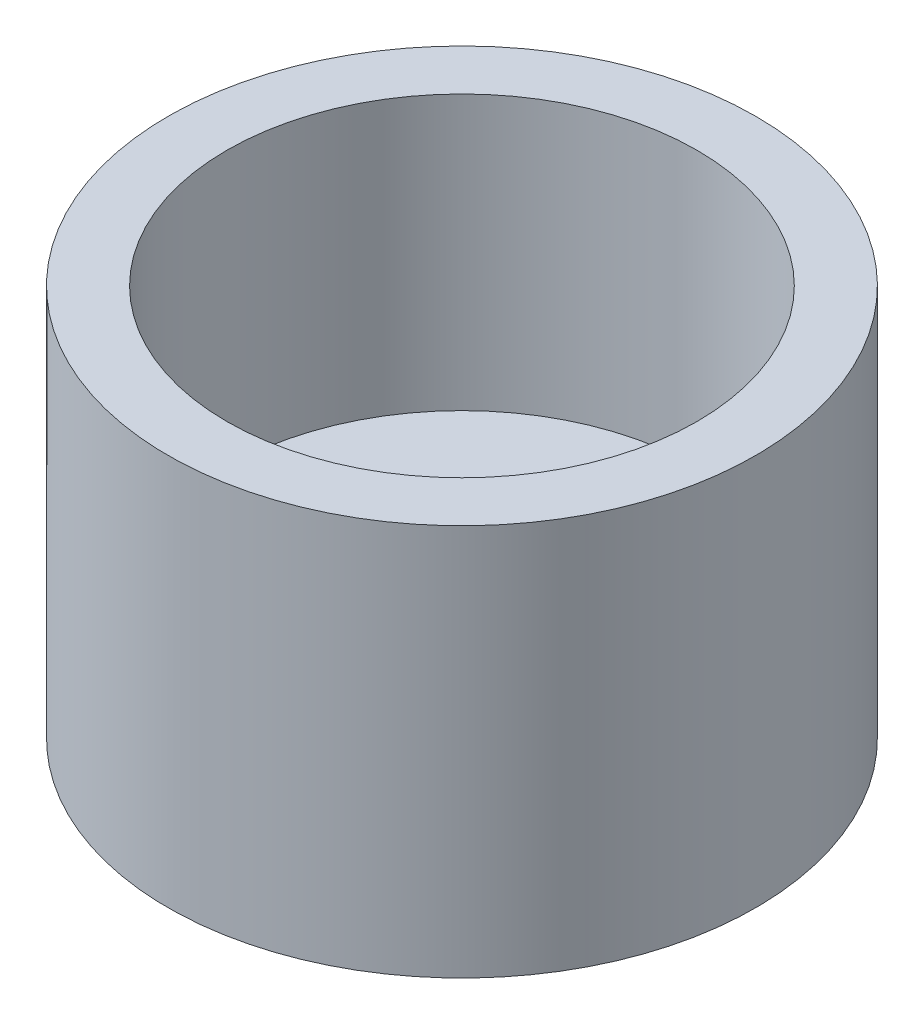
from build123d import *

# Parameters (mm, degrees)
SCHIZZO2_R               = 1.585
TAGLIO_ESTRUSIONE1_DEPTH = 10


with BuildPart() as part:
    # Schizzo1 → Rivoluzione1 (revolve)
    with BuildSketch(Plane.XY):
        Polygon((0, 0), (-15, 0), (-15, 20), (-12, 20), (-12, 6), (0, 6), align=None)
    revolve(axis=Axis((0, 0, 0), (0, 1, 0)))

    # Schizzo2 → Taglio-Estrusione1 (cut)
    with BuildSketch(Plane.XZ):
        Circle(SCHIZZO2_R)
    extrude(amount=-TAGLIO_ESTRUSIONE1_DEPTH, mode=Mode.SUBTRACT)


solid = part.part
